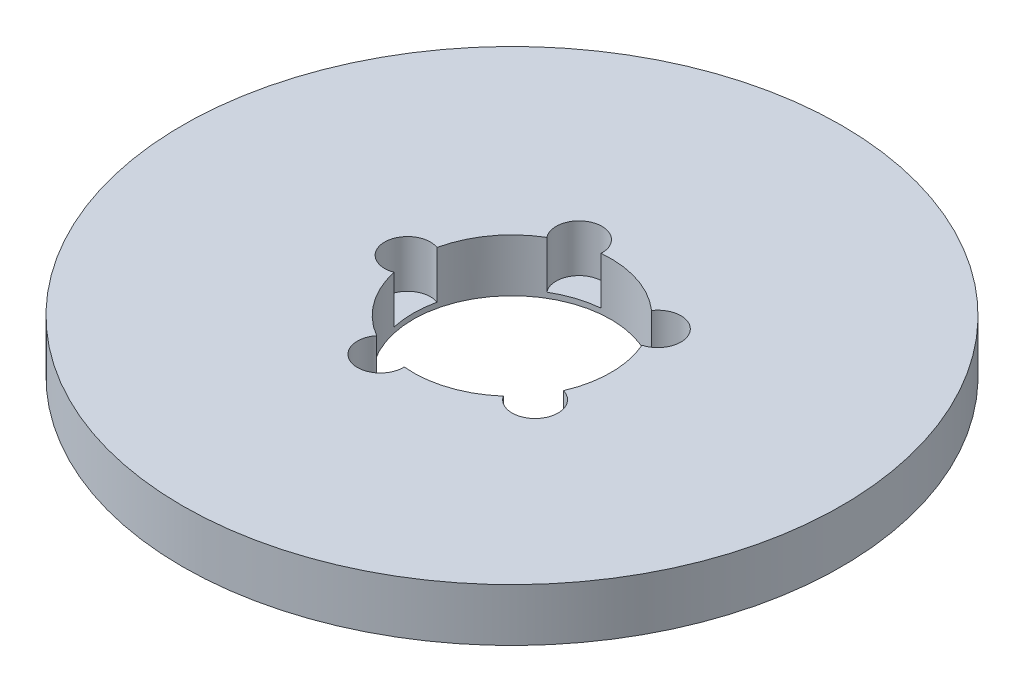
from build123d import *

# Parameters (mm, degrees)
SKETCH1_R           = 25
BOSS_EXTRUDE1_DEPTH = 4
SKETCH2_R           = 7.5
CUT_EXTRUDE1_DEPTH  = 36.580893749
SKETCH3_R           = 1.7407464
CUT_EXTRUDE2_DEPTH  = 3.597877343
CIRPATTERN1_COUNT   = 5


with BuildPart() as part:
    # Sketch1 → Boss-Extrude1 (new body)
    with BuildSketch(Plane(origin=(0, 0, 0), x_dir=(1, 0, 0), z_dir=(0, 1, 0))):
        Circle(SKETCH1_R)
    extrude(amount=BOSS_EXTRUDE1_DEPTH)

    # Sketch2 → Cut-Extrude1 (cut, through all)
    with BuildSketch(Plane(origin=(0, 0, 0), x_dir=(1, 0, 0), z_dir=(0, 1, 0))):
        Circle(SKETCH2_R)
    extrude(amount=CUT_EXTRUDE1_DEPTH, mode=Mode.SUBTRACT)

    # Sketch3 → Cut-Extrude2 (cut)
    with BuildSketch(Plane(origin=(0, 4, 0), x_dir=(1, 0, 0), z_dir=(0, 1, 0))):
        with Locations((-7.923889063, 0)):
            Circle(SKETCH3_R)
    cut_extrude2 = extrude(amount=-CUT_EXTRUDE2_DEPTH, mode=Mode.SUBTRACT)

    # CirPattern1: Cut-Extrude2 ×5 about axis
    cirpattern1_axis = Axis((0, 0, 0), (0, 1, 0))
    for i in range(1, CIRPATTERN1_COUNT):
        add(cut_extrude2.rotate(cirpattern1_axis, i * 360 / CIRPATTERN1_COUNT), mode=Mode.SUBTRACT)


solid = part.part
